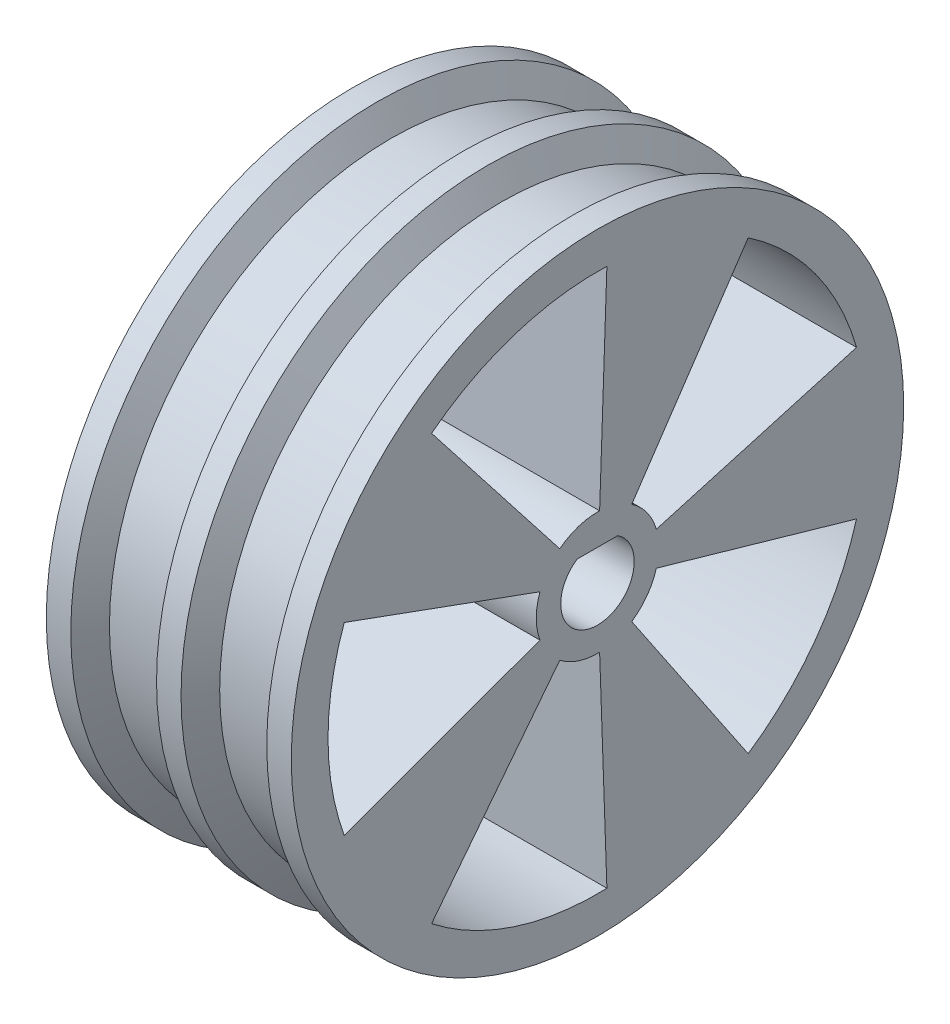
from build123d import *
from OCP.BRepFilletAPI import BRepFilletAPI_MakeChamfer

# Parameters (mm, degrees)
BASE_DEPTH          = 10
BASE_DEPTH_BACK     = 10
ESQUISSE1_R         = 25
ESQUISSE2_R         = 25
ESQUISSE2_R_2       = 23
VIDE_GORGE_DEPTH    = 7
VIDE_JANTE_DEPTH    = 20
ESQUISSE6_R         = 3
VIDE_BLOC_AXE_DEPTH = 4
CHAN_EXT_SIZE       = 2
CHAN_EXT_SIZE_2     = 1.154700538
CHAN_INT_SIZE       = 1.154700538
CHAN_INT_SIZE_2     = 2


with BuildPart() as part:
    # Esquisse1 → BASE (new, two sides: drawn at the far end of the back side and taken through both)
    with BuildSketch(Plane(origin=(0, 0, 0), x_dir=(0, 0, -1), z_dir=(1, 0, 0)).offset(-BASE_DEPTH_BACK)):
        Circle(ESQUISSE1_R)
        with BuildLine():
            Line((-1.658312395, 2.5), (1.658312395, 2.5))
            ThreePointArc((1.658312395, 2.5), (0, -3), (-1.658312395, 2.5))
        make_face(mode=Mode.SUBTRACT)
    extrude(amount=BASE_DEPTH + BASE_DEPTH_BACK)

    # Esquisse2 → VIDE GORGE (cut)
    with BuildSketch(Plane.ZY.offset(8)):
        with Locations(Location((0, 0, 0), (0, 0, 180))):
            Circle(ESQUISSE2_R)
        Circle(ESQUISSE2_R_2, mode=Mode.SUBTRACT)
    vide_gorge = extrude(amount=-VIDE_GORGE_DEPTH, mode=Mode.SUBTRACT)

    # SYM GORGE: VIDE GORGE across plane
    add(vide_gorge.mirror(Plane(origin=(0, 0, 0), x_dir=(0, 0, 1), z_dir=(1, 0, 0))), mode=Mode.SUBTRACT)

    # Esquisse4 → VIDE JANTE (cut)
    with BuildSketch(Plane(origin=(10, 0, 0), x_dir=(0, 0, -1), z_dir=(1, 0, 0))):
        with BuildLine():
            Line((-22, 0), (-5, 0))
            ThreePointArc((-5, 0), (-4.924038765, 0.868240888), (-4.698463104, 1.710100717))
            Line((-4.698463104, 1.710100717), (-20.673237657, 7.524443153))
            ThreePointArc((-20.673237657, 7.524443153), (-21.665770566, 3.820259909), (-22, 0))
        make_face()
        with BuildLine():
            ThreePointArc((-4.698463104, -1.710100717), (-4.924038765, -0.868240888), (-5, 0))
            Line((-5, 0), (-22, 0))
            ThreePointArc((-22, 0), (-21.665770566, -3.820259909), (-20.673237657, -7.524443153))
            Line((-20.673237657, -7.524443153), (-4.698463104, -1.710100717))
        make_face()
        with BuildLine():
            Line((-13.544552457, 17.336236579), (-3.078307377, 3.940053768))
            ThreePointArc((-3.078307377, 3.940053768), (-1.545084972, 4.755282581), (0.174497484, 4.996954135))
            Line((0.174497484, 4.996954135), (0.767788927, 21.986598194))
            ThreePointArc((0.767788927, 21.986598194), (-6.798373876, 20.923243358), (-13.544552457, 17.336236579))
        make_face()
        with BuildLine():
            Line((12.302243876, 18.238826596), (2.795964517, 4.145187863))
            ThreePointArc((2.795964517, 4.145187863), (4.045084972, 2.938926261), (4.80630848, 1.378186779))
            Line((4.80630848, 1.378186779), (21.147757311, 6.064021828))
            ThreePointArc((21.147757311, 6.064021828), (17.798373876, 12.93127555), (12.302243876, 18.238826596))
        make_face()
        with BuildLine():
            ThreePointArc((4.80630848, -1.378186779), (4.045084972, -2.938926261), (2.795964517, -4.145187863))
            Line((2.795964517, -4.145187863), (12.302243876, -18.238826596))
            ThreePointArc((12.302243876, -18.238826596), (17.798373876, -12.93127555), (21.147757311, -6.064021828))
            Line((21.147757311, -6.064021828), (4.80630848, -1.378186779))
        make_face()
        with BuildLine():
            ThreePointArc((0.174497484, -4.996954135), (-1.545084972, -4.755282581), (-3.078307377, -3.940053768))
            Line((-3.078307377, -3.940053768), (-13.544552457, -17.336236579))
            ThreePointArc((-13.544552457, -17.336236579), (-6.798373876, -20.923243358), (0.767788927, -21.986598194))
            Line((0.767788927, -21.986598194), (0.174497484, -4.996954135))
        make_face()
    extrude(amount=-VIDE_JANTE_DEPTH, mode=Mode.SUBTRACT)

    # Esquisse6 → VIDE BLOC AXE (cut)
    with BuildSketch(Plane.ZY.offset(10)):
        with Locations(Location((0, 0, 0), (0, 0, 180))):
            Circle(ESQUISSE6_R)
    extrude(amount=-VIDE_BLOC_AXE_DEPTH, mode=Mode.SUBTRACT)

    # CHAN EXT
    chan_ext_edges_1 = [part.edges().sort_by_distance(p)[0] for p in [
        (-8, 0, -23),
    ]]
    chan_ext_side_1 = [part.faces().sort_by_distance(p)[0] for p in [
        (-8, 0, -23.023094011),
    ]]
    chan_ext_edges_2 = [part.edges().sort_by_distance(p)[0] for p in [
        (8, 0, -23),
    ]]
    chan_ext_side_2 = [part.faces().sort_by_distance(p)[0] for p in [
        (7.976905989, 0, -23),
    ]]
    chan_ext = BRepFilletAPI_MakeChamfer(part.part.solid().wrapped)
    for e in chan_ext_edges_1:
        chan_ext.Add(CHAN_EXT_SIZE - 0.0001, CHAN_EXT_SIZE_2 - 0.0001, e.wrapped, chan_ext_side_1[0].wrapped)
    for e in chan_ext_edges_2:
        chan_ext.Add(CHAN_EXT_SIZE_2 - 0.0001, CHAN_EXT_SIZE - 0.0001, e.wrapped, chan_ext_side_2[0].wrapped)
    add(Compound.cast(chan_ext.Shape()), mode=Mode.REPLACE)  # a hair under: the kernel refuses the full size

    # CHAN INT
    chan_int_edges_1 = [part.edges().sort_by_distance(p)[0] for p in [
        (-1, 0, -23),
    ]]
    chan_int_side_1 = [part.faces().sort_by_distance(p)[0] for p in [
        (-1.023094011, 0, -23),
    ]]
    chan_int_edges_2 = [part.edges().sort_by_distance(p)[0] for p in [
        (1, 0, -23),
    ]]
    chan_int_side_2 = [part.faces().sort_by_distance(p)[0] for p in [
        (1, 0, -23.023094011),
    ]]
    chan_int = BRepFilletAPI_MakeChamfer(part.part.solid().wrapped)
    for e in chan_int_edges_1:
        chan_int.Add(CHAN_INT_SIZE - 0.0001, CHAN_INT_SIZE_2 - 0.0001, e.wrapped, chan_int_side_1[0].wrapped)
    for e in chan_int_edges_2:
        chan_int.Add(CHAN_INT_SIZE_2 - 0.0001, CHAN_INT_SIZE - 0.0001, e.wrapped, chan_int_side_2[0].wrapped)
    add(Compound.cast(chan_int.Shape()), mode=Mode.REPLACE)  # a hair under: the kernel refuses the full size


solid = part.part
